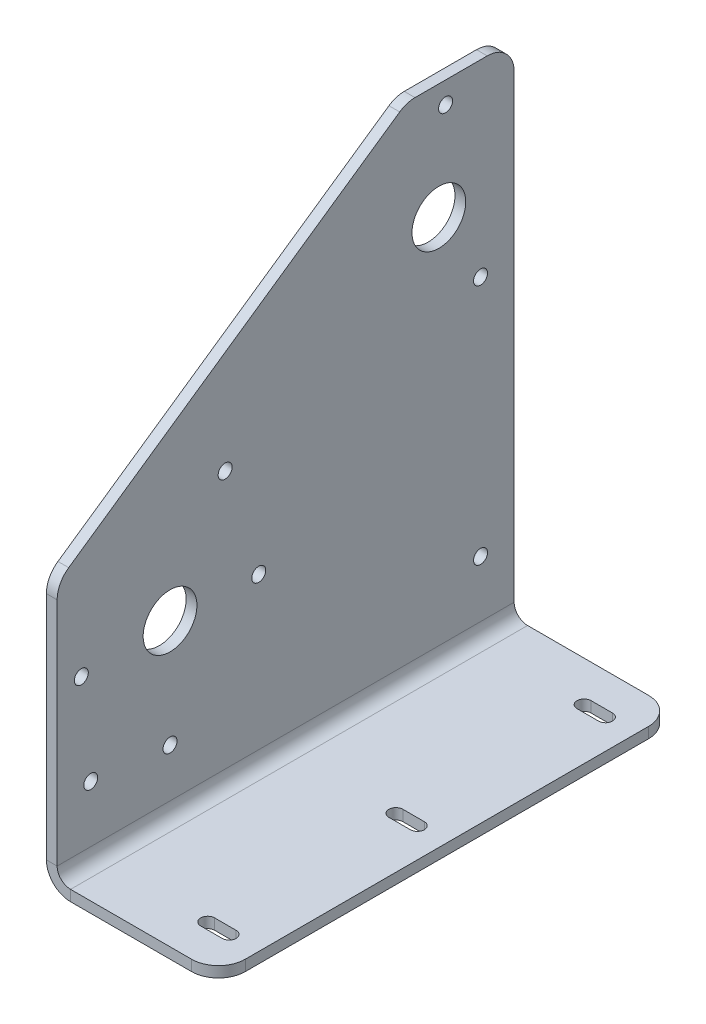
from build123d import *

# Parameters (mm, degrees)
SKETCH1_W                    = 60
SKETCH1_H                    = 170
BASE_FLANGE1_DEPTH           = 4
EDGE_FLANGE1_STRIP_W         = 26
EDGE_FLANGE1_STRIP_H         = 4
EDGE_FLANGE1_STRIP_CUT_DEPTH = 170
EDGE_FLANGE1_DEPTH           = 170
SKETCH15_R                   = 10
CUT_EXTRUDE4_DEPTH           = 10
CUT_EXTRUDE5_DEPTH           = 10
FILLET1_R                    = 10
F_1_0MM_DOWEL_HOLE2_D        = 5.2
F_1_0MM_DOWEL_HOLE2_DEPTH    = 12.03
F_1_0MM_DOWEL_HOLE2_TIP      = 1.562237609
SKETCH33_R                   = 2.6
CUT_EXTRUDE6_DEPTH           = 7
F_1_0MM_DOWEL_HOLE3_D        = 5.2
F_1_0MM_DOWEL_HOLE3_DEPTH    = 12.03
F_1_0MM_DOWEL_HOLE3_TIP      = 1.562237609
CUT_EXTRUDE7_DEPTH           = 10


# Sheet-metal steps are written as plain solids
with BuildPart() as part:
    # Sketch1 → Base-Flange1 (new body)
    with BuildSketch(Plane(origin=(0, 0, 0), x_dir=(1, 0, 0), z_dir=(0, 1, 0))):
        Rectangle(SKETCH1_W, SKETCH1_H)
    extrude(amount=-BASE_FLANGE1_DEPTH)

    # Edge-Flange1 strip (across the edge) → Edge-Flange1 strip cut (cut)
    with BuildSketch(Plane(origin=(-30, 0, -85), x_dir=(1, 0, 0), z_dir=(0, 0, 1))):
        with Locations((-8, -2)):
            Rectangle(EDGE_FLANGE1_STRIP_W, EDGE_FLANGE1_STRIP_H)
    extrude(amount=EDGE_FLANGE1_STRIP_CUT_DEPTH, mode=Mode.SUBTRACT)

    # Edge-Flange1 section (across the edge) → Edge-Flange1 (add)
    with BuildSketch(Plane(origin=(-30, 0, -85), x_dir=(1, 0, 0), z_dir=(0, 0, 1))):
        with BuildLine():
            Line((-4, 5), (-4, 186))
            Line((-4, 186), (0, 186))
            Line((0, 186), (0, 5))
            ThreePointArc((0, 5), (1.464466094, 1.464466094), (5, 0))
            Line((5, 0), (5, -4))
            ThreePointArc((5, -4), (-1.363961031, -1.363961031), (-4, 5))
        make_face()
    extrude(amount=EDGE_FLANGE1_DEPTH)

    # Sketch15 → Cut-Extrude4 (cut)
    with BuildSketch(Plane(origin=(-30, 0, 0), x_dir=(0, 0, -1), z_dir=(1, 0, 0))):
        with Locations(Location((-43, 63, 0), (0, 0, 90))):
            Circle(SKETCH15_R)
        with Locations(Location((57, 143, 0), (0, 0, 90))):
            Circle(SKETCH15_R)
    extrude(amount=-CUT_EXTRUDE4_DEPTH, mode=Mode.SUBTRACT)

    # Sketch16 → Cut-Extrude5 (cut)
    with BuildSketch(Plane(origin=(-30, 0, 0), x_dir=(0, 0, -1), z_dir=(1, 0, 0))):
        Polygon((-85, 96), (45, 186), (-85, 186), align=None)
    extrude(amount=-CUT_EXTRUDE5_DEPTH, mode=Mode.SUBTRACT)

    # Fillet1
    fillet1_edges = [part.edges().sort_by_distance(p)[0] for p in [
        (-32, 186, -85),
        (-32, 186, -45),
        (-32, 96, 85),
        (30, -2, 85),
        (30, -2, -85),
    ]]
    fillet(fillet1_edges, radius=FILLET1_R)

    # Ø1.0mm Dowel Hole2
    with Locations(Plane(origin=(-30, 0, 0), x_dir=(0, 0, -1), z_dir=(1, 0, 0))):
        with Locations((-72.5, 26), (72.5, 26), (72.5, 116), (-22.5, 101), (59.5, 178)):
            Hole(F_1_0MM_DOWEL_HOLE2_D / 2, depth=F_1_0MM_DOWEL_HOLE2_DEPTH)
            with Locations((0, 0, -(F_1_0MM_DOWEL_HOLE2_DEPTH + F_1_0MM_DOWEL_HOLE2_TIP / 2))):  # 118° drill point
                Cone(0, F_1_0MM_DOWEL_HOLE2_D / 2, F_1_0MM_DOWEL_HOLE2_TIP, mode=Mode.SUBTRACT)

    # Sketch33 → Cut-Extrude6 (cut)
    with BuildSketch(Plane(origin=(-30, 0, 0), x_dir=(0, 0, -1), z_dir=(1, 0, 0))):
        with Locations(Location((-10, 61.5, 0), (0, 0, 90))):
            Circle(SKETCH33_R)
        with Locations(Location((-76, 61.5, 0), (0, 0, 90))):
            Circle(SKETCH33_R)
        with Locations(Location((-43, 23, 0), (0, 0, 90))):
            Circle(SKETCH33_R)
    extrude(amount=-CUT_EXTRUDE6_DEPTH, mode=Mode.SUBTRACT)

    # Ø1.0mm Dowel Hole3
    with Locations(Plane(origin=(0, 0, 0), x_dir=(1, 0, 0), z_dir=(0, 1, 0))):
        with Locations((15, 70), (15, 0), (15, -70)):
            Hole(F_1_0MM_DOWEL_HOLE3_D / 2, depth=F_1_0MM_DOWEL_HOLE3_DEPTH)
            with Locations((0, 0, -(F_1_0MM_DOWEL_HOLE3_DEPTH + F_1_0MM_DOWEL_HOLE3_TIP / 2))):  # 118° drill point
                Cone(0, F_1_0MM_DOWEL_HOLE3_D / 2, F_1_0MM_DOWEL_HOLE3_TIP, mode=Mode.SUBTRACT)

    # Sketch36 → Cut-Extrude7 (cut)
    with BuildSketch(Plane(origin=(0, 0, 0), x_dir=(1, 0, 0), z_dir=(0, 1, 0))):
        with BuildLine():
            Line((11, 67.4), (19, 67.4))
            ThreePointArc((19, 67.4), (21.6, 70), (19, 72.6))
            Line((19, 72.6), (11, 72.6))
            ThreePointArc((11, 72.6), (8.4, 70), (11, 67.4))
        make_face()
        with BuildLine():
            Line((11, -2.6), (19, -2.6))
            ThreePointArc((19, -2.6), (21.6, 0), (19, 2.6))
            Line((19, 2.6), (11, 2.6))
            ThreePointArc((11, 2.6), (8.4, 0), (11, -2.6))
        make_face()
        with BuildLine():
            Line((11, -72.6), (19, -72.6))
            ThreePointArc((19, -72.6), (21.6, -70), (19, -67.4))
            Line((19, -67.4), (11, -67.4))
            ThreePointArc((11, -67.4), (8.4, -70), (11, -72.6))
        make_face()
    extrude(amount=-CUT_EXTRUDE7_DEPTH, mode=Mode.SUBTRACT)


solid = part.part
